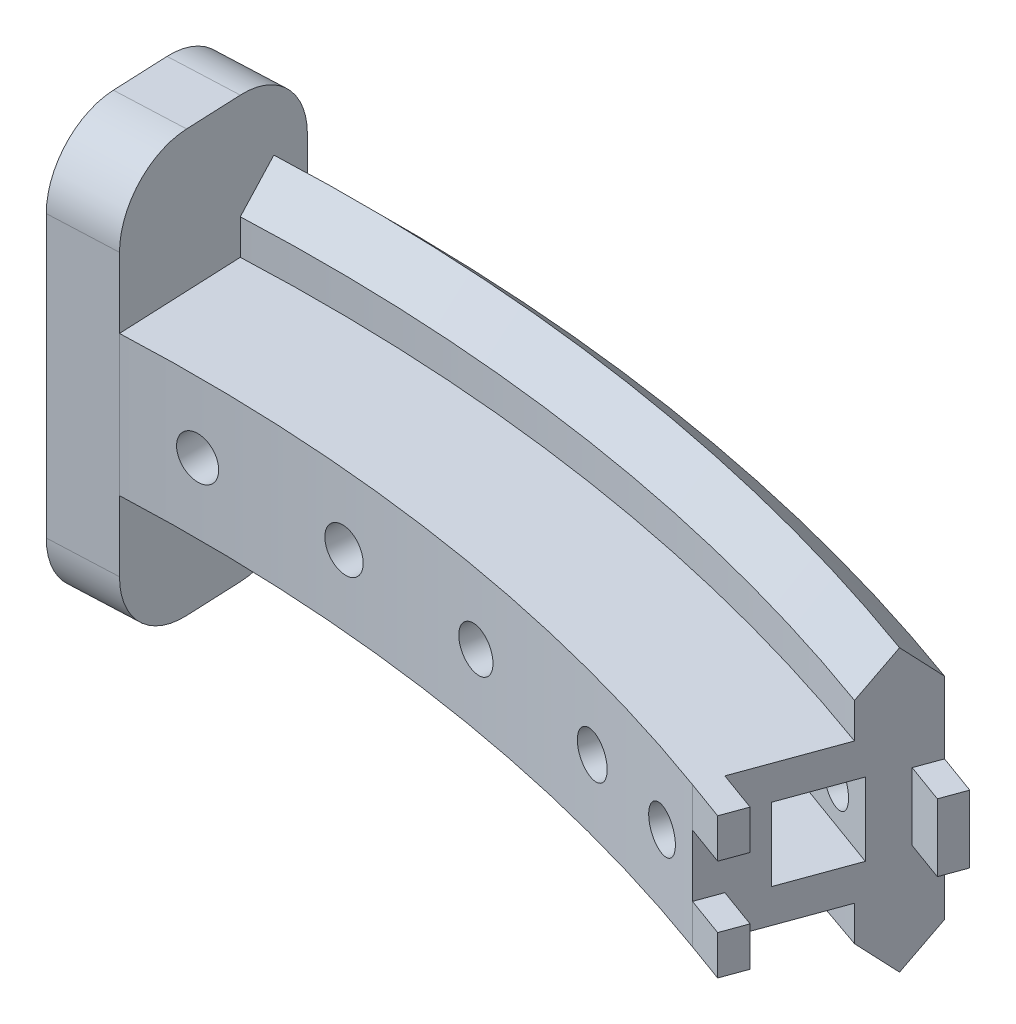
from build123d import *

# Parameters (mm, degrees)
REVOLVE_1_ANGLE          = 40
SKETCH_3_W               = 5.2
SKETCH_3_H               = 5.2
CUT_EXTRUDE_1_DEPTH      = 7
CUT_EXTRUDE_2_DEPTH      = 94.967026614
CUT_EXTRUDE_2_DEPTH_BACK = 94.967026614
SKETCH_5_R               = 1.5
CUT_EXTRUDE_START        = -2
SKETCH_6_R               = 3
CUT_EXTRUDE_3_DEPTH      = 93.938324905
SKETCH_12_R              = 1.5
CUT_EXTRUDE_5_DEPTH      = 54.141615619
CUT_EXTRUDE_6_DEPTH      = 5
PATTERN_CIRCULAR_1_COUNT = 4
PATTERN_CIRCULAR_1_ANGLE = 15
F_1_THE_OTHER_WAY_COUNT  = 4
F_1_THE_OTHER_WAY_ANGLE  = 15
SKETCH_9_W               = 1.8
SKETCH_9_H               = 4.8
SKETCH_9_H_2             = 2.8
EXTRUDE_2_DEPTH          = 3
SKETCH_10_W              = 52.448370613
SKETCH_10_H              = 39.953744926
CUT_EXTRUDE_4_DEPTH      = 149.179341739
SKETCH_11_W              = 14
SKETCH_11_H              = 30
EXTRUDE_3_DEPTH          = 5
FILLET_1_R               = 5


# Read off the part's stored shape, not the designer's step: 旋转1
with BuildPart() as part:
    # 旋转1 outline → 旋转1 (revolve)
    with BuildSketch(Plane(origin=(0, 0, 0), x_dir=(0.3420201433256701, 0, -0.9396926207859079), z_dir=(0.9396926207859079, 0, 0.3420201433256701))):
        Polygon((134, 5), (125, 5), (125, -5), (134, -5), (134, -7.5), (136.5, -10), (139, -7.5), (139, 7.5), (136.5, 10), (134, 7.5), align=None)
    revolve(axis=Axis((0, 0, 0), (0, 1, 0)), revolution_arc=REVOLVE_1_ANGLE)

    # 草图3 → 切除-拉伸1 (cut)
    with BuildSketch(Plane(origin=(0, 0, 0), x_dir=(0.34202014332566943, 0, -0.9396926207859081), z_dir=(0.9396926207859081, 0, 0.34202014332566943))):
        with Locations((132, 0)):
            Rectangle(SKETCH_3_W, SKETCH_3_H)
    extrude(amount=-CUT_EXTRUDE_1_DEPTH, mode=Mode.SUBTRACT)

    # 草图5 → 切除-拉伸2 (cut, two sides: drawn at the far end of the back side and taken through both)
    with BuildSketch(Plane(origin=(44.257406546, 0, -121.59622513), x_dir=(-0.9396926207859081, 0, -0.3420201433256695), z_dir=(0.3420201433256695, 0, -0.9396926207859081)).offset(-CUT_EXTRUDE_2_DEPTH_BACK)):
        with Locations((3.5, 0)):
            Circle(SKETCH_5_R)
    extrude(amount=CUT_EXTRUDE_2_DEPTH + CUT_EXTRUDE_2_DEPTH_BACK, mode=Mode.SUBTRACT)

    # 草图6 → 切除-拉伸3 (cut, through all)
    with BuildSketch(Plane(origin=(46.035911292, 0, -126.482626758), x_dir=(0.9396926207859081, 0, 0.3420201433256695), z_dir=(-0.3420201433256695, 0, 0.9396926207859081)).offset(CUT_EXTRUDE_START)):
        with Locations((-3.5, 0)):
            Circle(SKETCH_6_R)
    extrude(amount=-CUT_EXTRUDE_3_DEPTH, mode=Mode.SUBTRACT)

    # 草图12 → 切除-拉伸5 (cut, through all)
    with BuildSketch(Plane(origin=(0, 0, -139), x_dir=(-1, 0, 0), z_dir=(0, 0, -1))):
        Circle(SKETCH_12_R)
    cut_extrude_5 = extrude(amount=-CUT_EXTRUDE_5_DEPTH, mode=Mode.SUBTRACT)

    # 草图13 → 切除-拉伸6 (cut)
    with BuildSketch(Plane(origin=(0, 0, -139), x_dir=(-1, 0, 0), z_dir=(0, 0, -1))):
        Polygon((0, -3.175426481), (2.75, -1.58771324), (2.75, 1.58771324), (0, 3.175426481), (-2.75, 1.58771324), (-2.75, -1.58771324), align=None)
    cut_extrude_6 = extrude(amount=-CUT_EXTRUDE_6_DEPTH, mode=Mode.SUBTRACT)

    # 阵列(圆周)1: 切除-拉伸5, 切除-拉伸6 ×4 about axis
    pattern_circular_1_axis = Axis((0, 0, 0), (0, 1, 0))
    add([cut_extrude_5.rotate(pattern_circular_1_axis, i * PATTERN_CIRCULAR_1_ANGLE / (PATTERN_CIRCULAR_1_COUNT - 1)) for i in range(1, PATTERN_CIRCULAR_1_COUNT)], mode=Mode.SUBTRACT)
    add([cut_extrude_6.rotate(pattern_circular_1_axis, i * PATTERN_CIRCULAR_1_ANGLE / (PATTERN_CIRCULAR_1_COUNT - 1)) for i in range(1, PATTERN_CIRCULAR_1_COUNT)], mode=Mode.SUBTRACT)

    # 1 the other way: 切除-拉伸5, 切除-拉伸6 ×4 about axis
    f_1_the_other_way_axis = Axis((0, 0, 0), (0, -1, 0))
    add([cut_extrude_5.rotate(f_1_the_other_way_axis, i * F_1_THE_OTHER_WAY_ANGLE / (F_1_THE_OTHER_WAY_COUNT - 1)) for i in range(1, F_1_THE_OTHER_WAY_COUNT)], mode=Mode.SUBTRACT)
    add([cut_extrude_6.rotate(f_1_the_other_way_axis, i * F_1_THE_OTHER_WAY_ANGLE / (F_1_THE_OTHER_WAY_COUNT - 1)) for i in range(1, F_1_THE_OTHER_WAY_COUNT)], mode=Mode.SUBTRACT)

    # 草图9 → 凸台-拉伸2 (add)
    with BuildSketch(Plane(origin=(0, 0, 0), x_dir=(0.34202014332566943, 0, -0.9396926207859082), z_dir=(0.9396926207859082, 0, 0.34202014332566943))):
        with Locations((138.1, 0)):
            Rectangle(SKETCH_9_W, SKETCH_9_H)
        with Locations((125.9, 3.6)):
            Rectangle(SKETCH_9_W, SKETCH_9_H_2)
        with Locations((125.9, -3.6)):
            Rectangle(SKETCH_9_W, SKETCH_9_H_2)
    extrude(amount=EXTRUDE_2_DEPTH)

    # 草图10 → 切除-拉伸4 (cut, through all)
    with BuildSketch(Plane(origin=(0, 0, 0), x_dir=(0, -1, 0), z_dir=(0.9990482215818578, 0, -0.04361938736533606))):
        with Locations((1.816079314, 125.001454628)):
            Rectangle(SKETCH_10_W, SKETCH_10_H)
    extrude(amount=-CUT_EXTRUDE_4_DEPTH, mode=Mode.SUBTRACT)

    # 草图11 → 凸台-拉伸3 (add)
    with BuildSketch(Plane(origin=(0, 0, 0), x_dir=(0.043619387365336076, 0, 0.9990482215818578), z_dir=(-0.9990482215818577, 0, 0.04361938736533607))):
        with Locations((-132, 0)):
            Rectangle(SKETCH_11_W, SKETCH_11_H)
    extrude(amount=EXTRUDE_3_DEPTH)

    # 圆角1
    fillet_1_edges = [part.edges().sort_by_distance(p)[0] for p in [
        (-8.560715398, 15, -138.758654331),
        (-8.560715398, -15, -138.758654331),
        (-7.950043975, -15, -124.771979229),
        (-7.950043975, 15, -124.771979229),
    ]]
    fillet(fillet_1_edges, radius=FILLET_1_R)


solid = part.part
